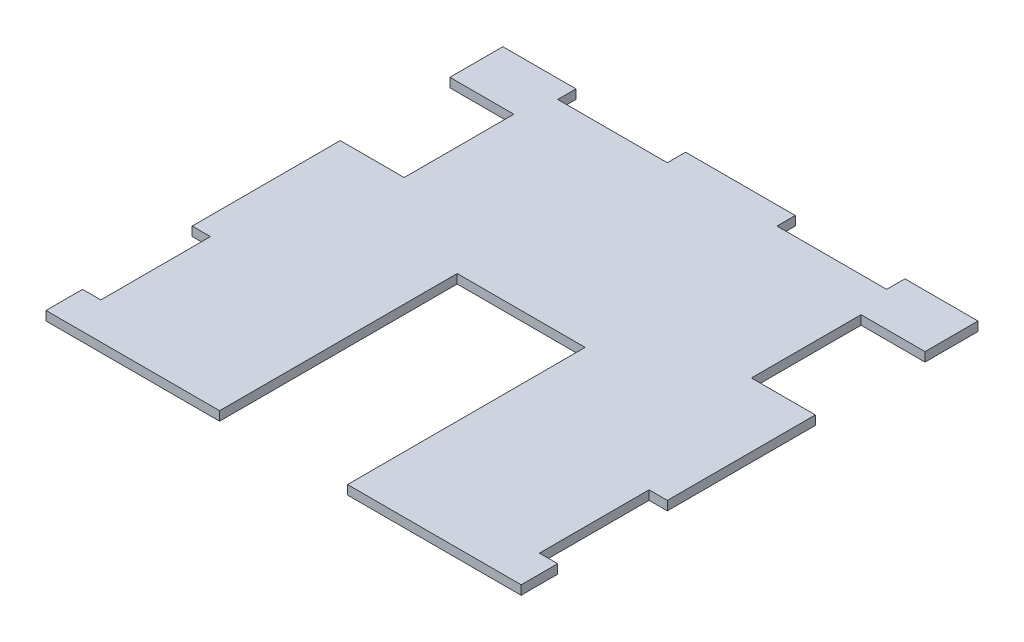
from build123d import *

# Parameters (mm, degrees)
BOSS_EXTRUDE1_DEPTH = 6.35
SKETCH2_W           = 44.45
SKETCH2_H           = 76.2
SKETCH2_W_2         = 12.7
SKETCH2_W_3         = 76.2
SKETCH2_H_2         = 12.7
CUT_EXTRUDE1_DEPTH  = 293.444905068


with BuildPart() as part:
    # Sketch1 → Boss-Extrude1 (new body)
    with BuildSketch(Plane(origin=(0, 0, 0), x_dir=(1, 0, 0), z_dir=(0, 1, 0))):
        Polygon((-165.1, 76.2), (-165.1, -241.3), (-44.45, -241.3), (-44.45, -76.2), (44.45, -76.2), (44.45, -241.3), (165.1, -241.3), (165.1, 76.2), align=None)
    extrude(amount=BOSS_EXTRUDE1_DEPTH)

    # Sketch2 → Cut-Extrude1 (cut, through all)
    with BuildSketch(Plane(origin=(0, 6.35, 0), x_dir=(1, 0, 0), z_dir=(0, 1, 0))):
        with Locations((142.875, 1.27)):
            Rectangle(SKETCH2_W, SKETCH2_H)
        with Locations((158.75, -177.8)):
            Rectangle(SKETCH2_W_2, SKETCH2_H)
        with Locations((-158.75, -177.8)):
            Rectangle(SKETCH2_W_2, SKETCH2_H)
        with Locations((-142.875, 1.27)):
            Rectangle(SKETCH2_W, SKETCH2_H)
        with Locations((-76.2, 69.85)):
            Rectangle(SKETCH2_W_3, SKETCH2_H_2)
        with Locations((76.2, 69.85)):
            Rectangle(SKETCH2_W_3, SKETCH2_H_2)
    extrude(amount=-CUT_EXTRUDE1_DEPTH, mode=Mode.SUBTRACT)


solid = part.part
